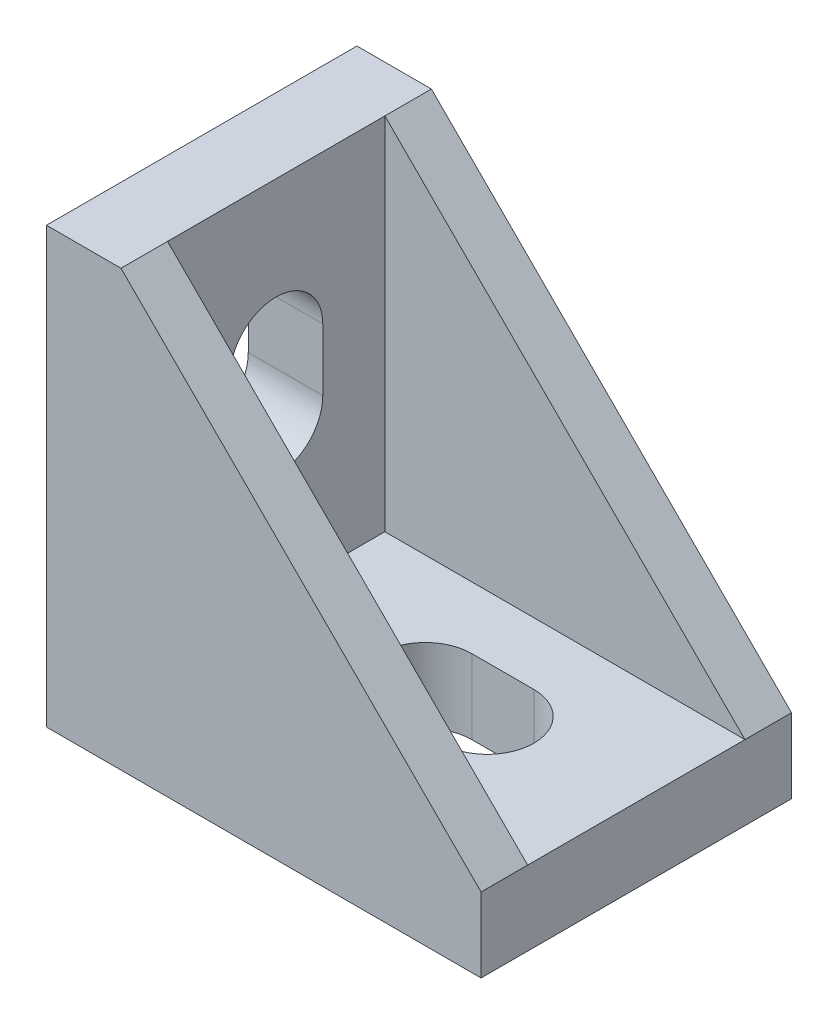
from build123d import *

# Parameters (mm, degrees)
SKETCH1_W           = 28
SKETCH1_H           = 20
BOSS_EXTRUDE1_DEPTH = 4.8
SKETCH2_W           = 20
SKETCH2_H           = 28
BOSS_EXTRUDE2_DEPTH = 4.8
CUT_EXTRUDE1_DEPTH  = 38.712597365
CUT_EXTRUDE2_DEPTH  = 29.883213118
BOSS_EXTRUDE3_DEPTH = 3
BOSS_EXTRUDE4_DEPTH = 3


with BuildPart() as part:
    # Sketch1 → Boss-Extrude1 (new body)
    with BuildSketch(Plane(origin=(0, 0, 0), x_dir=(1, 0, 0), z_dir=(0, 1, 0))):
        Rectangle(SKETCH1_W, SKETCH1_H)
    extrude(amount=BOSS_EXTRUDE1_DEPTH)

    # Sketch2 → Boss-Extrude2 (add)
    with BuildSketch(Plane.ZY.offset(14)):
        with Locations((0, 14)):
            Rectangle(SKETCH2_W, SKETCH2_H)
    extrude(amount=-BOSS_EXTRUDE2_DEPTH)

    # Sketch3 → Cut-Extrude1 (cut, through all)
    with BuildSketch(Plane(origin=(-9.2, 0, 0), x_dir=(0, 0, -1), z_dir=(1, 0, 0))):
        with BuildLine():
            Line((3, 18.4), (3, 14.4))
            ThreePointArc((3, 14.4), (0, 11.4), (-3, 14.4))
            Line((-3, 14.4), (-3, 18.4))
            ThreePointArc((-3, 18.4), (0, 21.4), (3, 18.4))
        make_face()
    extrude(amount=-CUT_EXTRUDE1_DEPTH, mode=Mode.SUBTRACT)

    # Sketch4 → Cut-Extrude2 (cut, through all)
    with BuildSketch(Plane(origin=(0, 4.8, 0), x_dir=(1, 0, 0), z_dir=(0, 1, 0))):
        with BuildLine():
            Line((0.4, 3), (4.4, 3))
            ThreePointArc((4.4, 3), (7.4, 0), (4.4, -3))
            Line((4.4, -3), (0.4, -3))
            ThreePointArc((0.4, -3), (-2.6, 0), (0.4, 3))
        make_face()
    extrude(amount=-CUT_EXTRUDE2_DEPTH, mode=Mode.SUBTRACT)

    # Sketch5 → Boss-Extrude3 (add)
    with BuildSketch(Plane.XY.offset(10)):
        Polygon((-9.2, 28), (14, 4.8), (-9.2, 4.8), align=None)
    extrude(amount=-BOSS_EXTRUDE3_DEPTH)

    # Sketch6 → Boss-Extrude4 (add)
    with BuildSketch(Plane(origin=(0, 0, -10), x_dir=(-1, 0, 0), z_dir=(0, 0, -1))):
        Polygon((9.2, 28), (9.2, 4.8), (-14, 4.8), align=None)
    extrude(amount=-BOSS_EXTRUDE4_DEPTH)


solid = part.part
